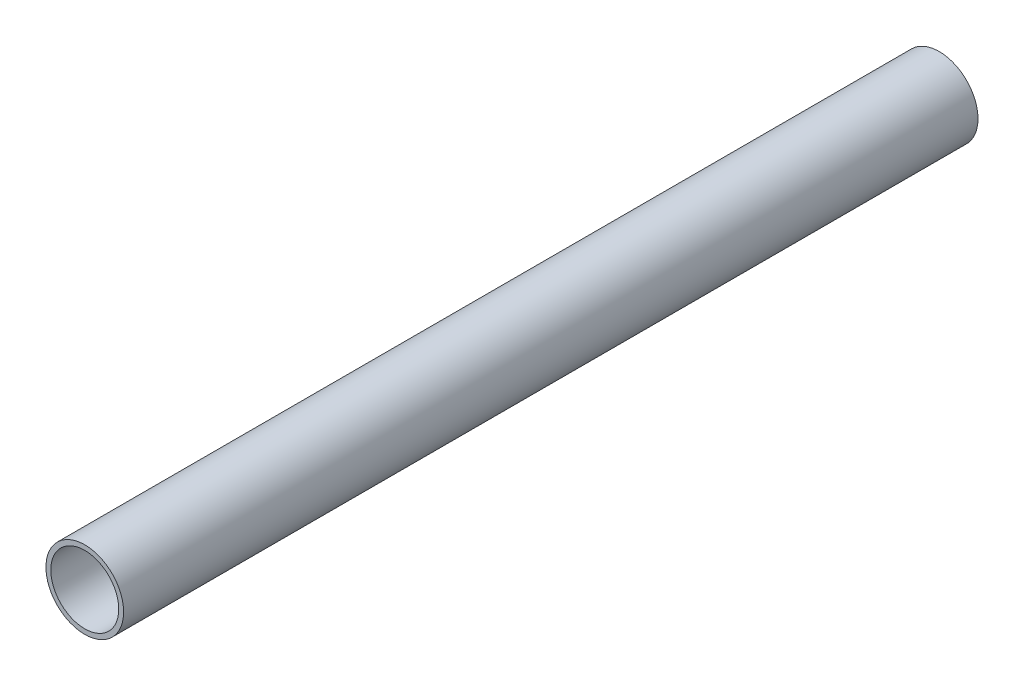
from build123d import *

# Parameters (mm, degrees)
SKETCH1_R           = 25.4
SKETCH1_R_2         = 22.225
BOSS_EXTRUDE1_DEPTH = 279.4


with BuildPart() as part:
    # Sketch1 → Boss-Extrude1 (new, symmetric)
    with BuildSketch(Plane.XY):
        Circle(SKETCH1_R)
        Circle(SKETCH1_R_2, mode=Mode.SUBTRACT)
    extrude(amount=BOSS_EXTRUDE1_DEPTH, both=True)


solid = part.part
